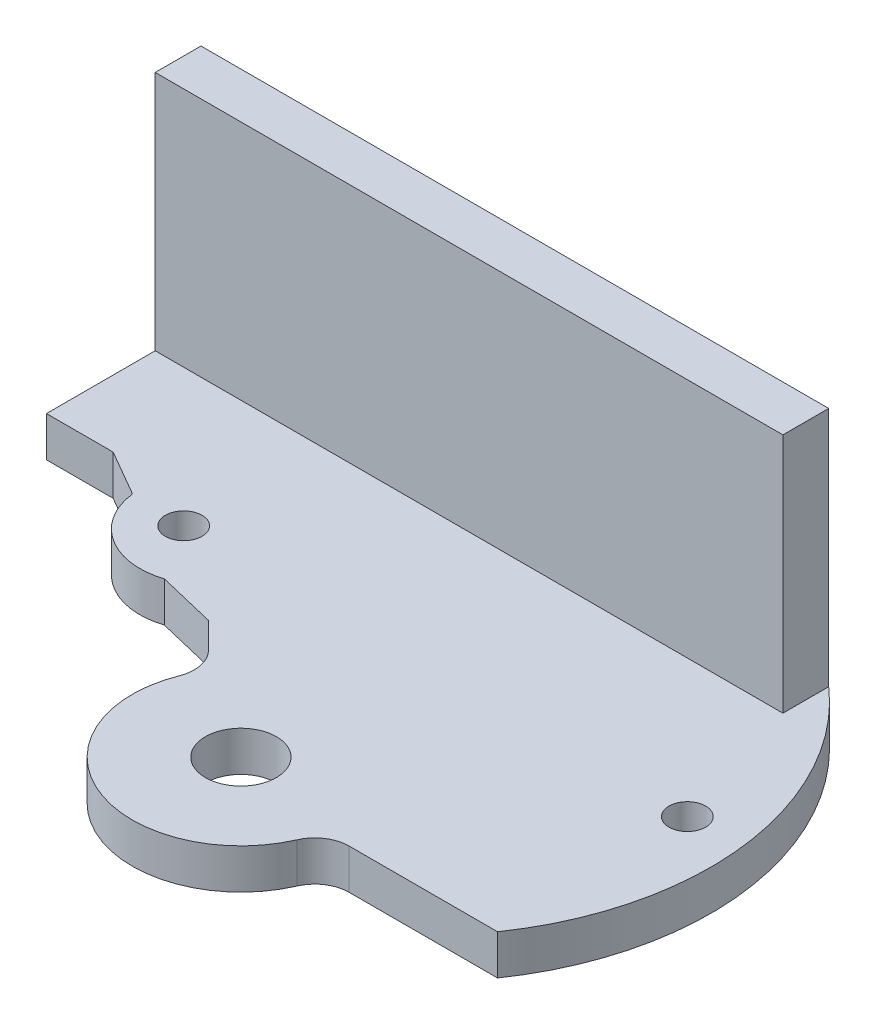
from build123d import *
from build123d.topology import SkipClean

# Parameters (mm, degrees)
CROQUIS1_W              = 70
CROQUIS1_H              = 65
EXTRUIR1_DEPTH          = 3.5
CROQUIS2_R              = 3.1
EXTRUIR2_DEPTH          = 5
EXTRUIR3_DEPTH          = 10
CROQUIS4_OUTSIDE_W      = 91.294
CROQUIS4_OUTSIDE_H      = 86.294
EXTRUIR4_DEPTH          = 10
REDONDEO1_R             = 3
EXTRUIR5_DEPTH          = 13.5
EXTRUIR6_DEPTH          = 3.5
CROQUIS7_R              = 1.6
EXTRUIR7_DEPTH          = 47.982330447
CROQUIS8_R              = 3.1
EXTRUIR8_DEPTH          = 5
CROQUIS9_W              = 0.7
CROQUIS9_H              = 10.5
EXTRUIR9_DEPTH          = 10
EXTRUIR10_DEPTH         = 63.752948337
EXTRUIR10_DEPTH_BACK    = 10
CROQUIS10_W             = 3.0625
CROQUIS10_H             = 5
CROQUIS11_W             = 54.8364
CROQUIS11_H             = 21.05596306
SALIENTE_EXTRUIR1_DEPTH = 4


with BuildPart() as part:
    # Croquis1 → Extruir1 (new body)
    with BuildSketch(Plane(origin=(0, 0, 0), x_dir=(1, 0, 0), z_dir=(0, 1, 0))):
        Rectangle(CROQUIS1_W, CROQUIS1_H)
    extrude(amount=EXTRUIR1_DEPTH)

    # Croquis2 → Extruir2 (cut)
    with BuildSketch(Plane(origin=(0, 3.5, 0), x_dir=(1, 0, 0), z_dir=(0, 1, 0))):
        with Locations(Location((0, -17.5, 0), (0, 0, 270))):
            Circle(CROQUIS2_R)
    extrude(amount=-EXTRUIR2_DEPTH, mode=Mode.SUBTRACT)

    # Croquis3 → Extruir3 (add)
    with BuildSketch(Plane(origin=(0, 3.5, 0), x_dir=(1, 0, 0), z_dir=(0, 1, 0))):
        with BuildLine():
            Line((-34.4868, 13.5), (20.3496, 13.5))
            Line((20.3496, 13.5), (20.3496, 0))
            Line((20.3496, 0), (17.146428199, 0))
            ThreePointArc((17.146428199, 0), (22.955777517, -8.939493087), (24.418230894, -19.5))
            Line((24.418230894, -19.5), (9.287087811, -19.5))
            ThreePointArc((9.287087811, -19.5), (-3.635492607, -26.276855559), (-7.981176331, -12.347250794))
            Line((-7.981176331, -12.347250794), (-18.680510212, -1.647916913))
            ThreePointArc((-18.680510212, -1.647916913), (-17.932408832, -0.806327142), (-17.146428199, 0))
            Line((-17.146428199, 0), (-34.4868, 0))
            Line((-34.4868, 0), (-34.4868, 13.5))
        make_face()
        with BuildLine():
            Line((-32.9868, 1.5), (-12.961481397, 1.5))
            ThreePointArc((-12.961481397, 1.5), (-14.868021343, 0.048274597), (-16.613165932, -1.593940849))
            Line((-16.613165932, -1.593940849), (-5.999348286, -12.207758495))
            ThreePointArc((-5.999348286, -12.207758495), (-3.061467459, -24.89103626), (7.984359711, -18))
            Line((7.984359711, -18), (22.994564575, -18))
            ThreePointArc((22.994564575, -18), (20.451694563, -6.977253708), (12.961481397, 1.5))
            Line((12.961481397, 1.5), (18.8496, 1.5))
            Line((18.8496, 1.5), (18.8496, 12))
            Line((18.8496, 12), (-32.9868, 12))
            Line((-32.9868, 12), (-32.9868, 1.5))
        make_face(mode=Mode.SUBTRACT)
    extrude(amount=EXTRUIR3_DEPTH)

    # Croquis4 outside → Extruir4 (cut)
    with SkipClean():  # the faces are left unmerged after this step: merging them gives an invalid solid
        with BuildSketch(Plane(origin=(0, 3.5, 0), x_dir=(1, 0, 0), z_dir=(0, 1, 0))):
            Rectangle(CROQUIS4_OUTSIDE_W, CROQUIS4_OUTSIDE_H)
            with BuildLine():
                Line((-34.4868, 0), (-17.146428199, 0))
                ThreePointArc((-17.146428199, 0), (-17.932408832, -0.806327142), (-18.680510212, -1.647916913))
                Line((-18.680510212, -1.647916913), (-7.981176331, -12.347250794))
                ThreePointArc((-7.981176331, -12.347250794), (-3.635492607, -26.276855559), (9.287087811, -19.5))
                Line((9.287087811, -19.5), (24.418230894, -19.5))
                ThreePointArc((24.418230894, -19.5), (22.955777517, -8.939493087), (17.146428199, 0))
                Line((17.146428199, 0), (20.3496, 0))
                Line((20.3496, 0), (20.3496, 13.5))
                Line((20.3496, 13.5), (-34.4868, 13.5))
                Line((-34.4868, 13.5), (-34.4868, 0))
            make_face(mode=Mode.SUBTRACT)
        extrude(amount=-EXTRUIR4_DEPTH, mode=Mode.SUBTRACT)

    # Redondeo1
    redondeo1_edges = [part.edges().sort_by_distance(p)[0] for p in [
        (-7.981176331, 8.5, 12.347250794),
        (9.287087811, 8.5, 19.5),
        (-5.999348286, 8.5, 12.207758495),
        (7.984359711, 8.5, 18),
    ]]
    fillet(redondeo1_edges, radius=REDONDEO1_R)

    # Croquis5 → Extruir5 (add)
    with SkipClean():  # the faces are left unmerged after this step: merging them gives an invalid solid
        with BuildSketch(Plane.XZ):
            with BuildLine():
                Line((-18.680510212, 1.647916913), (-14.437869525, 5.8905576))
                ThreePointArc((-14.437869525, 5.8905576), (-21.723092903, 6.819250451), (-24.449770984, 0))
                Line((-24.449770984, 0), (-17.146428199, 0))
                ThreePointArc((-17.146428199, 0), (-17.932408832, 0.806327142), (-18.680510212, 1.647916913))
            make_face()
            with BuildLine():
                Line((20.3496, 0), (20.3496, -13.5))
                ThreePointArc((20.3496, -13.5), (28.665212431, 2.225567304), (24.418230894, 19.5))
                ThreePointArc((24.418230894, 19.5), (22.955777517, 8.939493087), (17.146428199, 0))
                Line((17.146428199, 0), (20.3496, 0))
            make_face()
        extrude(amount=-EXTRUIR5_DEPTH)

    # Chaflán1
    # the kernel refuses this chamfer: 5, 4.044665138 mm, written as the material it adds along each edge
    with BuildSketch(Plane(origin=(-14.437869525, 3.5, 5.8905576), x_dir=(-0.8528028654224412, 0, 0.5222329678670944), z_dir=(0, 1, 0))) as chafl_n1_piece_1:
        with BuildLine():
            Line((2.946399951, -0.141421356), (-1.029187491, 3.834166086))
            Line((-1.029187491, 3.834166086), (-1.126417207, 3.810791264))
            ThreePointArc((-1.126417207, 3.810791264), (-0.561046898, 1.905915324), (-0.097229716, -0.023374822))
            Line((-0.097229716, -0.023374822), (0.023374822, -0.097229716))
            ThreePointArc((0.023374822, -0.097229716), (1.474874577, 0.065772974), (2.923025129, -0.238651072))
            Line((2.923025129, -0.238651072), (2.946399951, -0.141421356))
        make_face()
    extrude(amount=10)
    with BuildSketch(Plane(origin=(-24.449770984, 3.5, 0), x_dir=(-0.08263556343231732, 0, 0.9965798330571533), z_dir=(0, 1, 0))) as chafl_n1_piece_2:
        with BuildLine():
            Line((2.416506842, 0.180832589), (0.262590721, -4.378032196))
            Line((0.262590721, -4.378032196), (0.162932738, -4.386295752))
            ThreePointArc((0.162932738, -4.386295752), (0.081510488, -2.193144218), (-0.099657983, -0.008263556))
            Line((-0.099657983, -0.008263556), (0.019425577, 0.098095091))
            ThreePointArc((0.019425577, 0.098095091), (1.209024094, -0.014134236), (2.397081265, 0.278927681))
            Line((2.397081265, 0.278927681), (2.416506842, 0.180832589))
        make_face()
    extrude(amount=10)
    with BuildSketch(Plane(origin=(-24.449770984, 0, 0), x_dir=(-1, 0, 0), z_dir=(0, 1, 0))) as chafl_n1_piece_3:
        with BuildLine():
            Line((4.384757927, -0.10008854), (0.019475293, 2.423185189))
            Line((0.019475293, 2.423185189), (-0.079889541, 2.411932193))
            ThreePointArc((-0.079889541, 2.411932193), (0.113994282, 1.203721039), (-0.096154346, 0.027465282))
            Line((-0.096154346, 0.027465282), (0, -0.1))
            ThreePointArc((0, -0.1), (2.192378963, -0.1), (4.384757927, -0.20008854))
            Line((4.384757927, -0.20008854), (4.384757927, -0.10008854))
        make_face()
    extrude(amount=3.5)
    with BuildSketch(Plane(origin=(-14.437869525, 0, 5.8905576), x_dir=(0.7071067811865478, 0, 0.7071067811865472), z_dir=(0, 1, 0))) as chafl_n1_piece_4:
        with BuildLine():
            Line((3.968519544, 0.104446594), (-0.826219316, -2.831719321))
            Line((-0.826219316, -2.831719321), (-0.91529167, -2.786264775))
            ThreePointArc((-0.91529167, -2.786264775), (-0.280798425, -1.449390681), (-0.1, 0))
            Line((-0.1, 0), (0, 0.1))
            ThreePointArc((0, 0.1), (1.984259772, 0.1), (3.968519544, 0.204446594))
            Line((3.968519544, 0.204446594), (3.968519544, 0.104446594))
        make_face()
    extrude(amount=3.5)


with BuildPart() as body_2:
    # Croquis6 → Extruir6 (new body)
    with BuildSketch(Plane(origin=(0, 13.5, 0), x_dir=(1, 0, 0), z_dir=(0, 1, 0))):
        with BuildLine():
            Line((-34.4868, 13.5), (-34.4868, 0))
            Line((-34.4868, 0), (-28.661374979, 0))
            Line((-28.661374979, 0), (-24.642400208, -2.323096648))
            ThreePointArc((-24.642400208, -2.323096648), (-21.929637735, -6.692039268), (-16.829963308, -7.355409896))
            Line((-16.829963308, -7.355409896), (-11.752306982, -8.576120143))
            Line((-11.752306982, -8.576120143), (-9.515139435, -10.813287689))
            ThreePointArc((-9.515139435, -10.813287689), (-8.69974084, -12.321679102), (-8.843709432, -14.030302105))
            ThreePointArc((-8.843709432, -14.030302105), (-3.635492607, -26.276855559), (8.70689382, -21.3))
            ThreePointArc((8.70689382, -21.3), (9.813271565, -19.99001992), (11.456439237, -19.5))
            Line((11.456439237, -19.5), (24.418230894, -19.5))
            ThreePointArc((24.418230894, -19.5), (28.665212431, -2.225567304), (20.3496, 13.5))
            Line((20.3496, 13.5), (-34.4868, 13.5))
        make_face()
    extrude(amount=EXTRUIR6_DEPTH)


with BuildPart() as extruir7_tool:
    # Croquis7 → Extruir7 (new, through all)
    with BuildSketch(Plane(origin=(0, 17, 0), x_dir=(1, 0, 0), z_dir=(0, 1, 0))):
        with Locations(Location((-20, -2.5, 0), (0, 0, 270))):
            Circle(CROQUIS7_R)
        with Locations(Location((24, -2.5, 0), (0, 0, 270))):
            Circle(CROQUIS7_R)
    extrude(amount=-EXTRUIR7_DEPTH)


with BuildPart() as part_1:
    add(part.part)

    # Extruir7: cut by extruir7_tool
    add(extruir7_tool.part, mode=Mode.SUBTRACT)

    # Croquis9 → Extruir9 (cut)
    with BuildSketch(Plane(origin=(0, 13.5, 0), x_dir=(1, 0, 0), z_dir=(0, 1, 0))):
        with Locations((19.1996, 6.75)):
            Rectangle(CROQUIS9_W, CROQUIS9_H)
    extrude(amount=-EXTRUIR9_DEPTH, mode=Mode.SUBTRACT)

    # Croquis10 → Extruir10 (cut, two sides: drawn at the far end of the back side and taken through both)
    with BuildSketch(Plane.ZY.offset(-19.5496).offset(-EXTRUIR10_DEPTH_BACK)):
        with Locations((-8.9375, 8.5)):
            Rectangle(CROQUIS10_W, CROQUIS10_H)
    extrude(amount=EXTRUIR10_DEPTH + EXTRUIR10_DEPTH_BACK, mode=Mode.SUBTRACT)


with BuildPart() as body_2_1:
    add(body_2.part)

    # Extruir7: cut by extruir7_tool
    add(extruir7_tool.part, mode=Mode.SUBTRACT)

    # Croquis8 → Extruir8 (cut)
    with BuildSketch(Plane(origin=(0, 17, 0), x_dir=(1, 0, 0), z_dir=(0, 1, 0))):
        with Locations(Location((0, -17.5, 0), (0, 0, 270))):
            Circle(CROQUIS8_R)
    extrude(amount=-EXTRUIR8_DEPTH, mode=Mode.SUBTRACT)

    # Croquis11 → Saliente-Extruir1 (add)
    with BuildSketch(Plane(origin=(0, 0, -13.5), x_dir=(-1, 0, 0), z_dir=(0, 0, -1))):
        with Locations((7.0686, 27.52798153)):
            Rectangle(CROQUIS11_W, CROQUIS11_H)
    extrude(amount=-SALIENTE_EXTRUIR1_DEPTH)


solid = body_2_1.part
